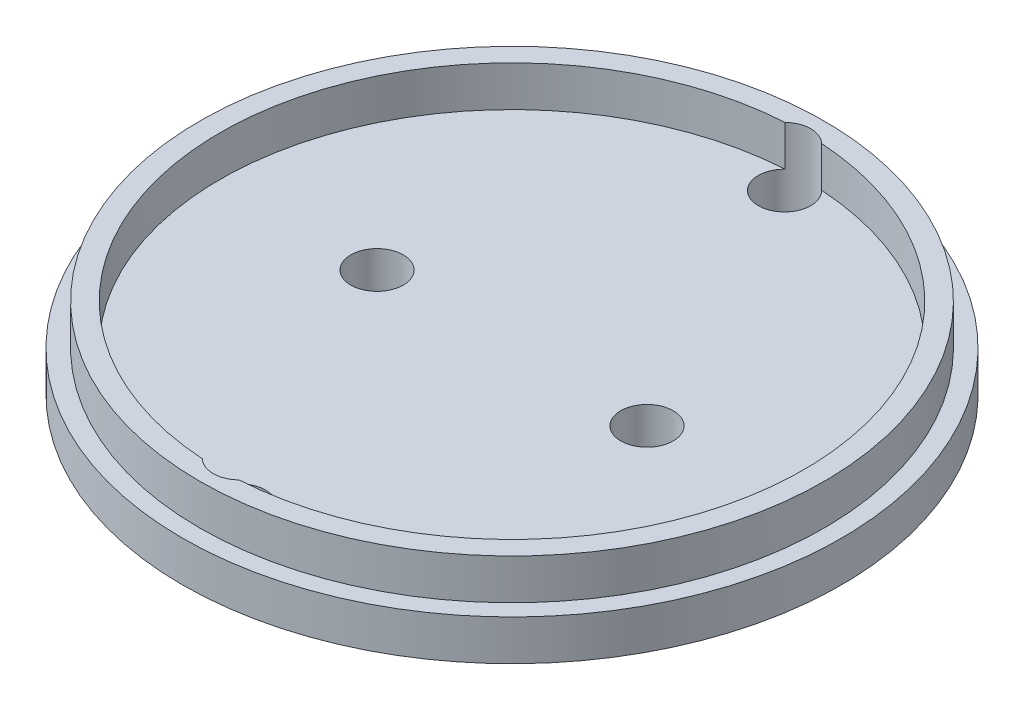
from build123d import *

# Parameters (mm, degrees)
SKETCH1_R               = 38.55
SKETCH1_R_2             = 36.05
BOSS_EXTRUDE1_DEPTH     = 5
SKETCH1_4_R             = 40.7
BOSS_EXTRUDE2_DEPTH     = 5
CUT_EXTRUDE1_DEPTH      = 59.420715504
CUT_EXTRUDE1_DEPTH_BACK = 59.420715504
SKETCH4_R               = 3.2385


with BuildPart() as part:
    # Sketch1 → Boss-Extrude1 (new body)
    with BuildSketch(Plane(origin=(0, 0, 0), x_dir=(1, 0, 0), z_dir=(0, 1, 0))):
        Circle(SKETCH1_R)
        Circle(SKETCH1_R_2, mode=Mode.SUBTRACT)
    extrude(amount=BOSS_EXTRUDE1_DEPTH)

    # Sketch1<4> → Boss-Extrude2 (add)
    with BuildSketch(Plane(origin=(0, 0, 0), x_dir=(1, 0, 0), z_dir=(0, 1, 0))):
        Circle(SKETCH1_4_R)
    extrude(amount=-BOSS_EXTRUDE2_DEPTH)

    # Sketch4 → Cut-Extrude1 (cut, two sides: drawn at the far end of the back side and taken through both)
    with BuildSketch(Plane.XZ.offset(5).offset(-CUT_EXTRUDE1_DEPTH_BACK)):
        with Locations((-16.66875, 0)):
            Circle(SKETCH4_R)
        with Locations((16.66875, 0)):
            Circle(SKETCH4_R)
        with Locations((0, 33.655)):
            Circle(SKETCH4_R)
        with Locations((0, -33.655)):
            Circle(SKETCH4_R)
    extrude(amount=CUT_EXTRUDE1_DEPTH + CUT_EXTRUDE1_DEPTH_BACK, mode=Mode.SUBTRACT)


solid = part.part
